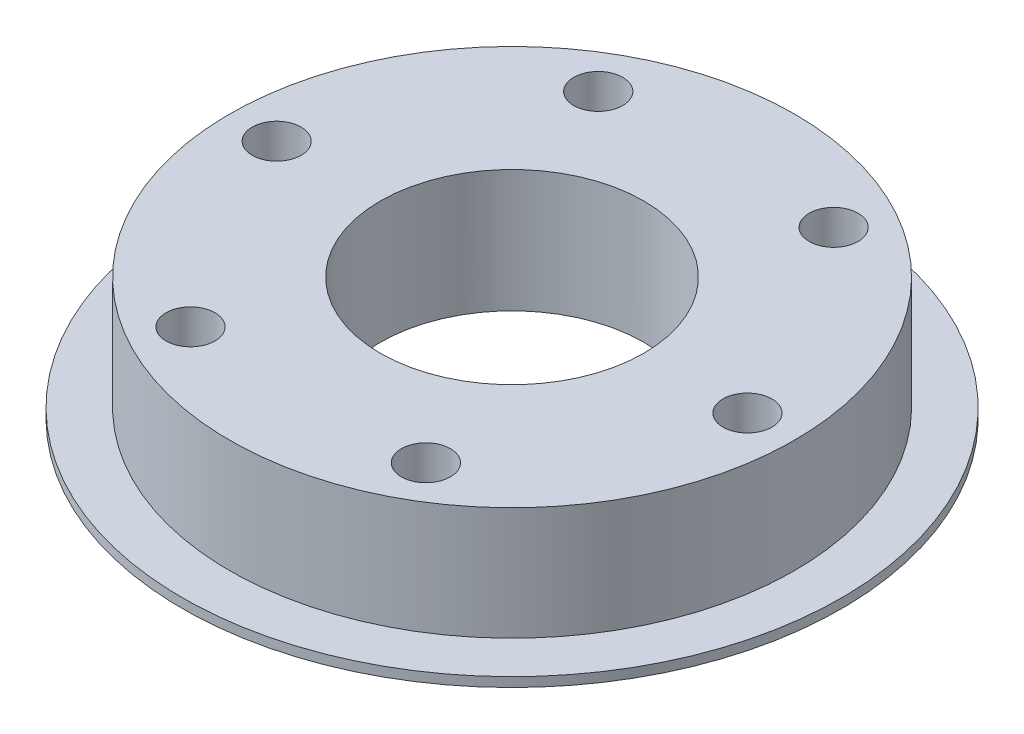
from build123d import *

# Parameters (mm, degrees)
SKETCH1_R           = 30
BOSS_EXTRUDE1_DEPTH = 13
SKETCH2_R           = 35
BOSS_EXTRUDE2_DEPTH = 1
SKETCH3_R           = 1.75
CUT_EXTRUDE1_DEPTH  = 3.5
SKETCH4_R           = 14
CUT_EXTRUDE2_DEPTH  = 51
SKETCH5_R           = 2.6
CUT_EXTRUDE3_DEPTH  = 25


with BuildPart() as part:
    # Sketch1 → Boss-Extrude1 (new body)
    with BuildSketch(Plane(origin=(0, 0, 0), x_dir=(1, 0, 0), z_dir=(0, 1, 0))):
        Circle(SKETCH1_R)
    extrude(amount=BOSS_EXTRUDE1_DEPTH)

    # Sketch2 → Boss-Extrude2 (add)
    with BuildSketch(Plane.XZ):
        Circle(SKETCH2_R)
    extrude(amount=-BOSS_EXTRUDE2_DEPTH)

    # Sketch3 → Cut-Extrude1 (cut)
    with BuildSketch(Plane(origin=(0, 0, 0), x_dir=(1, 0, 0), z_dir=(0, 1, 0))):
        with Locations((0, 25)):
            Circle(SKETCH3_R)
        with Locations((21.650635095, 12.5)):
            Circle(SKETCH3_R)
        with Locations((21.650635095, -12.5)):
            Circle(SKETCH3_R)
        with Locations((0, -25)):
            Circle(SKETCH3_R)
        with Locations((-21.650635095, -12.5)):
            Circle(SKETCH3_R)
        with Locations((-21.650635095, 12.5)):
            Circle(SKETCH3_R)
    extrude(amount=CUT_EXTRUDE1_DEPTH, mode=Mode.SUBTRACT)

    # Sketch4 → Cut-Extrude2 (cut)
    with BuildSketch(Plane.XZ):
        Circle(SKETCH4_R)
    extrude(amount=-CUT_EXTRUDE2_DEPTH, mode=Mode.SUBTRACT)

    # Sketch5 → Cut-Extrude3 (cut)
    with BuildSketch(Plane.XZ):
        with Locations((-12.5, 21.650635095)):
            Circle(SKETCH5_R)
        with Locations((12.5, 21.650635095)):
            Circle(SKETCH5_R)
        with Locations((25, 0)):
            Circle(SKETCH5_R)
        with Locations((12.5, -21.650635095)):
            Circle(SKETCH5_R)
        with Locations((-12.5, -21.650635095)):
            Circle(SKETCH5_R)
        with Locations((-25, 0)):
            Circle(SKETCH5_R)
    extrude(amount=-CUT_EXTRUDE3_DEPTH, mode=Mode.SUBTRACT)


solid = part.part
